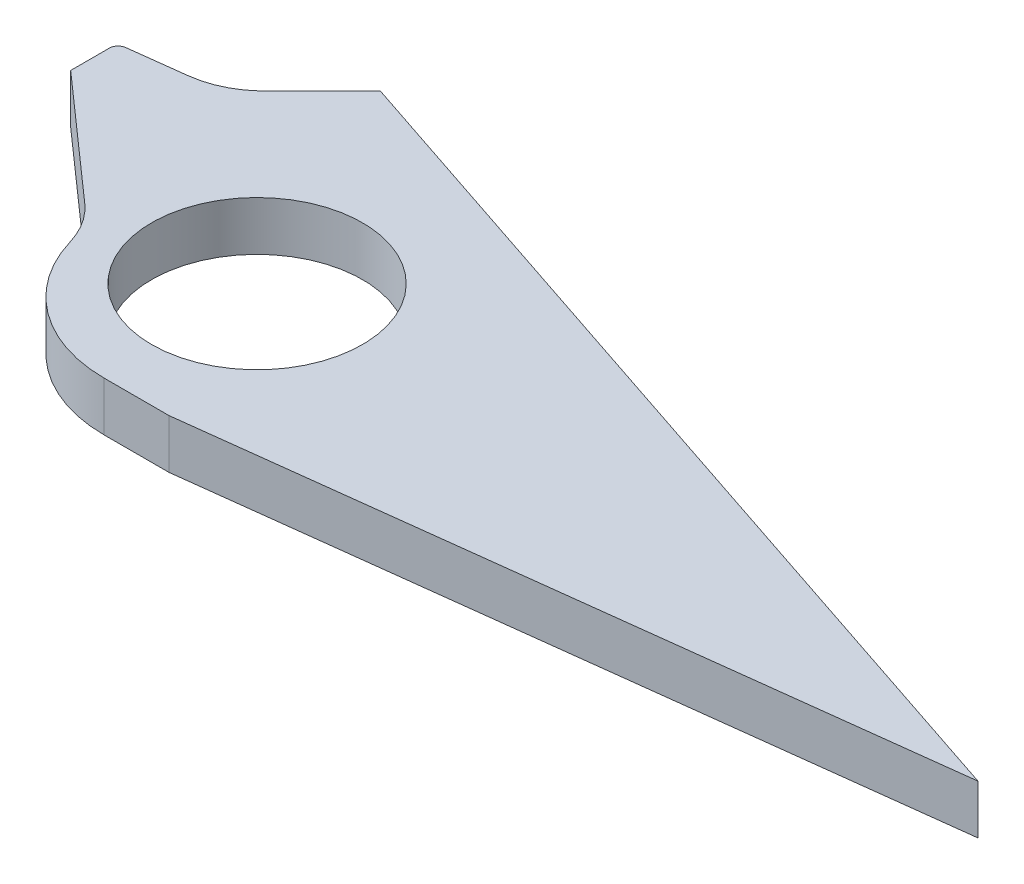
from build123d import *

# Parameters (mm, degrees)
SKETCH1_R           = 6
BOSS_EXTRUDE1_DEPTH = 2.8
CHAMFER1_SIZE       = 0.859491926
CHAMFER1_SIZE_2     = 7
FILLET4_R           = 5
FILLET5_R           = 0.5
FILLET10_R          = 5
FILLET11_R          = 8


with BuildPart() as part:
    # Sketch1 → Boss-Extrude1 (new body)
    with BuildSketch(Plane(origin=(0, 0, 0), x_dir=(1, 0, 0), z_dir=(0, 1, 0))):
        Polygon((-9, 10), (-6, 13), (45, -4), (4, -9), (-6, -9), (-7.660869565, -2), (-15.8, 5.2), (-15.8, 8.7), (-9, 8.7), align=None)
        with Locations(Location((0, 0, 0), (0, 0, 270))):
            Circle(SKETCH1_R, mode=Mode.SUBTRACT)
    extrude(amount=BOSS_EXTRUDE1_DEPTH)

    # Chamfer1
    # the kernel refuses this chamfer: 7, 0.859491926 mm, written as the material it takes off along each edge
    with BuildSketch(Plane(origin=(-15.8, -18.194982295, -8.7), x_dir=(-0.29696840376135825, 0, 0.9548873060039236), z_dir=(0, 1, 0))) as chamfer1_piece_1_section:
        Polygon((CHAMFER1_SIZE * 0.95488730636, CHAMFER1_SIZE * 0.296968403872), (-CHAMFER1_SIZE_2 * 0.296968403761, CHAMFER1_SIZE_2 * 0.954887306004), (0, 0), align=None)
    chamfer1_piece_1 = extrude(amount=39.18996459, mode=Mode.PRIVATE)
    chamfer1_piece_1 = split(chamfer1_piece_1, bisect_by=Plane(origin=(-9, 1.4, -8.488844691), z_dir=(-1, 0, 0)), keep=Keep.TOP, mode=Mode.PRIVATE)
    add(chamfer1_piece_1, mode=Mode.SUBTRACT)

    # Fillet4
    # the kernel refuses this fillet: 5 mm, written as the material it adds along each edge
    with BuildSketch(Plane(origin=(-9, 0, -8.675443088), x_dir=(-0.9925461516413187, 0, 0.12186934340517559), z_dir=(0, 1, 0))) as fillet4_piece_1:
        with BuildLine():
            CenterArc((3.217696086, -5), FILLET4_R, 90, 42.518155203)
            Line((-0.161422881, -1.314683866), (-0.229005261, -1.240977543))
            ThreePointArc((-0.229005261, -1.240977543), (-0.179966056, -0.645154999), (-0.099254615, 0.012186934))
            Line((-0.099254615, 0.012186934), (0, 0.1))
            Line((0, 0.1), (3.217696086, 0.1))
            Line((3.217696086, 0.1), (3.217696086, 0))
        make_face()
    extrude(amount=2.8)

    # Fillet5
    fillet5_edges = [part.edges().sort_by_distance(p)[0] for p in [
        (-15.8, 1.4, -7.840508074),
    ]]
    fillet(fillet5_edges, radius=FILLET5_R)

    # Fillet10
    fillet10_edges = [part.edges().sort_by_distance(p)[0] for p in [
        (-7.660869565, 1.4, 2),
    ]]
    fillet(fillet10_edges, radius=FILLET10_R)

    # Fillet11
    fillet11_edges = [part.edges().sort_by_distance(p)[0] for p in [
        (-6, 1.4, 9),
    ]]
    fillet(fillet11_edges, radius=FILLET11_R)


solid = part.part
